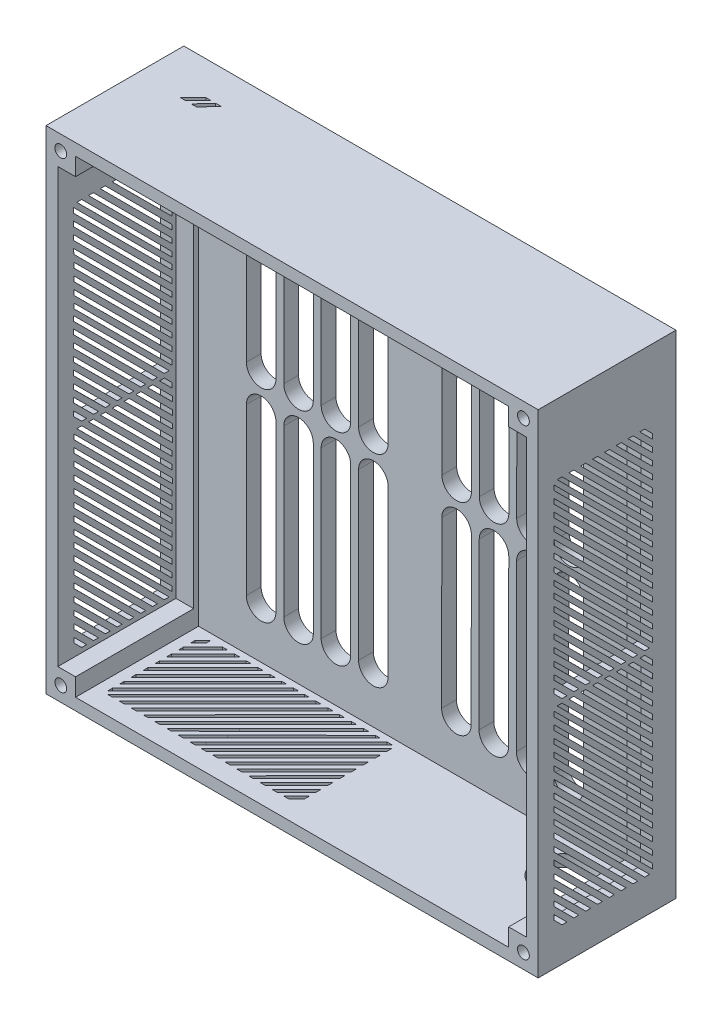
from build123d import *

# Parameters (mm, degrees)
ESBO_O1_W                = 250
ESBO_O1_H                = 250
RESSALTO_EXTRUS_O1_DEPTH = 70
ESBO_O2_W                = 238
ESBO_O2_H                = 238
CORTE_EXTRUS_O1_DEPTH    = 60
CORTE_EXTRUS_O2_DEPTH    = 341.014789418
ESBO_O7_W                = 220
ESBO_O7_H                = 229
CORTE_EXTRUS_O3_DEPTH    = 2.5
CORTE_EXTRUS_O4_DEPTH    = 284
ESBO_O10_W               = 9
ESBO_O10_H               = 9
RESSALTO_EXTRUS_O2_DEPTH = 60
ESBO_O11_R               = 3
CORTE_EXTRUS_O6_DEPTH    = 25
ESBO_O12_R               = 13.5
CORTE_EXTRUS_O7_DEPTH    = 10
CORTE_EXTRUS_O8_DEPTH    = 2


with BuildPart() as part:
    # Esboço1 → Ressalto-extrusão1 (new body)
    with BuildSketch(Plane.XY):
        with Locations((108.430425713, 114.833887043)):
            Rectangle(ESBO_O1_W, ESBO_O1_H)
    extrude(amount=RESSALTO_EXTRUS_O1_DEPTH)

    # Esboço2 → Corte-extrusão1 (cut)
    with BuildSketch(Plane.XY.offset(70)):
        with Locations((108.430425713, 114.833887043)):
            Rectangle(ESBO_O2_W, ESBO_O2_H)
    extrude(amount=-CORTE_EXTRUS_O1_DEPTH, mode=Mode.SUBTRACT)

    # Esboço6 → Corte-extrusão2 (cut, through all)
    with BuildSketch(Plane.XY.offset(10)):
        with BuildLine():
            Line((22.695507498, 208.167609342), (22.695507498, 124.153986831))
            ThreePointArc((22.695507498, 124.153986831), (30.195507498, 116.653986831), (37.695507498, 124.153986831))
            Line((37.695507498, 124.153986831), (37.695507498, 208.167609342))
            ThreePointArc((37.695507498, 208.167609342), (30.195507498, 215.667609342), (22.695507498, 208.167609342))
        make_face()
        with BuildLine():
            Line((41.695507498, 208.167609342), (41.695507498, 124.153986831))
            ThreePointArc((41.695507498, 124.153986831), (49.195507498, 116.653986831), (56.695507498, 124.153986831))
            Line((56.695507498, 124.153986831), (56.695507498, 208.167609342))
            ThreePointArc((56.695507498, 208.167609342), (49.195507498, 215.667609342), (41.695507498, 208.167609342))
        make_face()
        with BuildLine():
            Line((60.695507498, 208.167609342), (60.695507498, 124.153986831))
            ThreePointArc((60.695507498, 124.153986831), (68.195507498, 116.653986831), (75.695507498, 124.153986831))
            Line((75.695507498, 124.153986831), (75.695507498, 208.167609342))
            ThreePointArc((75.695507498, 208.167609342), (68.195507498, 215.667609342), (60.695507498, 208.167609342))
        make_face()
        with BuildLine():
            Line((79.695507498, 208.167609342), (79.695507498, 124.153986831))
            ThreePointArc((79.695507498, 124.153986831), (87.195507498, 116.653986831), (94.695507498, 124.153986831))
            Line((94.695507498, 124.153986831), (94.695507498, 208.167609342))
            ThreePointArc((94.695507498, 208.167609342), (87.195507498, 215.667609342), (79.695507498, 208.167609342))
        make_face()
        with BuildLine():
            Line((94.695507498, 105.513787255), (94.695507498, 21.500164744))
            ThreePointArc((94.695507498, 21.500164744), (87.195507498, 14.000164744), (79.695507498, 21.500164744))
            Line((79.695507498, 21.500164744), (79.695507498, 105.513787255))
            ThreePointArc((79.695507498, 105.513787255), (87.195507498, 113.013787255), (94.695507498, 105.513787255))
        make_face()
        with BuildLine():
            Line((75.695507498, 105.513787255), (75.695507498, 21.500164744))
            ThreePointArc((75.695507498, 21.500164744), (68.195507498, 14.000164744), (60.695507498, 21.500164744))
            Line((60.695507498, 21.500164744), (60.695507498, 105.513787255))
            ThreePointArc((60.695507498, 105.513787255), (68.195507498, 113.013787255), (75.695507498, 105.513787255))
        make_face()
        with BuildLine():
            Line((56.695507498, 105.513787256), (56.695507498, 21.500164744))
            ThreePointArc((56.695507498, 21.500164744), (49.195507498, 14.000164744), (41.695507498, 21.500164744))
            Line((41.695507498, 21.500164744), (41.695507498, 105.513787256))
            ThreePointArc((41.695507498, 105.513787256), (49.195507498, 113.013787256), (56.695507498, 105.513787256))
        make_face()
        with BuildLine():
            Line((37.695507498, 21.500164744), (37.695507498, 105.513787256))
            ThreePointArc((37.695507498, 105.513787256), (30.195507498, 113.013787256), (22.695507498, 105.513787256))
            Line((22.695507498, 105.513787256), (22.695507498, 21.500164744))
            ThreePointArc((22.695507498, 21.500164744), (30.195507498, 14.000164744), (37.695507498, 21.500164744))
        make_face()
        with BuildLine():
            Line((193.875104062, 21.383203899), (193.989910965, 105.396747967))
            ThreePointArc((193.989910965, 105.396747967), (186.500166922, 112.906989919), (178.989924971, 105.417245876))
            Line((178.989924971, 105.417245876), (178.875118068, 21.403701808))
            ThreePointArc((178.875118068, 21.403701808), (186.364862111, 13.893459856), (193.875104062, 21.383203899))
        make_face()
        with BuildLine():
            Line((174.875121802, 21.409167917), (174.989928706, 105.422711985))
            ThreePointArc((174.989928706, 105.422711985), (167.500184663, 112.932953936), (159.989942711, 105.443209893))
            Line((159.989942711, 105.443209893), (159.875135808, 21.429665825))
            ThreePointArc((159.875135808, 21.429665825), (167.364879851, 13.919423874), (174.875121802, 21.409167917))
        make_face()
        with BuildLine():
            Line((155.875139543, 21.435131934), (155.989946446, 105.448676002))
            ThreePointArc((155.989946446, 105.448676002), (148.500202403, 112.958917953), (140.989960451, 105.46917391))
            Line((140.989960451, 105.46917391), (140.875153548, 21.455629843))
            ThreePointArc((140.875153548, 21.455629843), (148.364897591, 13.945387891), (155.875139543, 21.435131934))
        make_face()
        with BuildLine():
            Line((136.875157283, 21.461095951), (136.989964186, 105.474640019))
            ThreePointArc((136.989964186, 105.474640019), (129.500220143, 112.984881971), (121.989978192, 105.495137928))
            Line((121.989978192, 105.495137928), (121.875171288, 21.48159386))
            ThreePointArc((121.875171288, 21.48159386), (129.364915331, 13.971351908), (136.875157283, 21.461095951))
        make_face()
        with BuildLine():
            Line((122.015450532, 124.135320099), (122.130257436, 208.148864167))
            ThreePointArc((122.130257436, 208.148864167), (129.640499387, 215.63860821), (137.13024343, 208.128366259))
            Line((137.13024343, 208.128366259), (137.015436527, 124.114822191))
            ThreePointArc((137.015436527, 124.114822191), (129.505194575, 116.625078148), (122.015450532, 124.135320099))
        make_face()
        with BuildLine():
            Line((141.015432792, 124.109356082), (141.130239695, 208.122900149))
            ThreePointArc((141.130239695, 208.122900149), (148.640481647, 215.612644192), (156.13022569, 208.102402241))
            Line((156.13022569, 208.102402241), (156.015418786, 124.088858173))
            ThreePointArc((156.015418786, 124.088858173), (148.505176835, 116.59911413), (141.015432792, 124.109356082))
        make_face()
        with BuildLine():
            Line((160.015415052, 124.083392064), (160.130221955, 208.096936132))
            ThreePointArc((160.130221955, 208.096936132), (167.640463907, 215.586680175), (175.13020795, 208.076438223))
            Line((175.13020795, 208.076438223), (175.015401046, 124.062894155))
            ThreePointArc((175.015401046, 124.062894155), (167.505159095, 116.573150112), (160.015415052, 124.083392064))
        make_face()
        with BuildLine():
            Line((179.130204215, 208.070972114), (179.015397311, 124.057428046))
            ThreePointArc((179.015397311, 124.057428046), (186.505141354, 116.547186095), (194.015383306, 124.036930138))
            Line((194.015383306, 124.036930138), (194.130190209, 208.050474206))
            ThreePointArc((194.130190209, 208.050474206), (186.640446166, 215.560716158), (179.130204215, 208.070972114))
        make_face()
    extrude(amount=-CORTE_EXTRUS_O2_DEPTH, mode=Mode.SUBTRACT)

    # Esboço7 → Corte-extrusão3 (cut)
    with BuildSketch(Plane.XY.offset(10)):
        with Locations((108.430425713, 110.333887043)):
            Rectangle(ESBO_O7_W, ESBO_O7_H)
    extrude(amount=-CORTE_EXTRUS_O3_DEPTH, mode=Mode.SUBTRACT)

    # Esboço8 → Corte-extrusão4 (cut)
    with BuildSketch(Plane.ZY.offset(16.569574287)):
        Polygon((11.920954387, 200.295216491), (15.882594698, 204.256856802), (18.382594698, 204.256856802), (11.920954387, 197.795216491), align=None)
        Polygon((11.877651038, 194.340054495), (21.78303626, 204.256856802), (24.382594698, 204.256856802), (11.879090975, 191.84005491), align=None)
        Polygon((11.887282735, 188.325338957), (27.8159346, 204.256856802), (30.382594698, 204.256856802), (11.887507622, 185.825338967), align=None)
        Polygon((11.889434685, 182.329414597), (33.819670411, 204.256856802), (36.382594698, 204.256856802), (11.889275447, 179.829414602), align=None)
        Polygon((11.890934109, 176.327179154), (39.837394675, 204.256856802), (42.382594698, 204.256856802), (11.890183211, 173.827179266), align=None)
        Polygon((11.964038432, 170.295408005), (45.882594698, 204.256856802), (48.42548723, 204.256856802), (11.964038432, 167.795408005), align=None)
        Polygon((11.921270161, 164.295532265), (51.929239829, 204.256856802), (54.432478905, 204.256856802), (11.921270161, 161.795532265), align=None)
        Polygon((11.8968556, 158.327055291), (57.882594698, 204.256856802), (60.382594698, 204.256856802), (11.895374458, 155.82705573), align=None)
        Polygon((61.937307697, 202.70030051), (61.934345413, 200.200302265), (15.950087018, 154.267754152), (11.920954387, 150.243177187), (11.920954387, 152.743177187), (13.450087457, 154.270499438), align=None)
        Polygon((61.930257324, 196.750188894), (61.927291202, 194.246951575), (24.4772154, 156.722273503), (11.961361665, 144.184457239), (11.964059174, 146.684455784), (21.984605044, 156.724963041), align=None)
        Polygon((61.923139558, 190.743201435), (61.92012645, 188.200310689), (30.416290711, 156.715865211), (11.954885602, 138.182570488), (11.957583112, 140.682569032), (27.877587947, 156.718604483), align=None)
        Polygon((61.915979252, 184.700313146), (61.91296341, 182.155114909), (36.456923768, 156.709347341), (11.948441986, 132.210755273), (11.951107294, 134.680909705), (33.919008845, 156.712085763), align=None)
        Polygon((61.90886977, 178.700317358), (61.905832927, 176.137394871), (42.454738132, 156.702875672), (11.941973741, 126.216113277), (11.944631982, 128.679718557), (39.924569035, 156.705605736), align=None)
        Polygon((61.901760289, 172.70032157), (61.898719018, 170.133663274), (48.446482457, 156.696410553), (11.935510496, 120.226106519), (11.938162819, 122.684226878), (45.924003427, 156.699132319), align=None)
        Polygon((61.894650807, 166.700325782), (61.891570555, 164.100769169), (54.466126239, 156.68991533), (11.929047597, 114.236419065), (11.931697999, 116.692759781), (51.95149329, 156.692628631), align=None)
        Polygon((61.887541326, 160.700329994), (61.884579042, 158.200331749), (60.366158963, 156.683549169), (11.922633829, 108.292266617), (11.922299432, 110.727656337), (57.858559852, 156.686254879), align=None)
        Polygon((13.477429253, 106.735792656), (15.912817195, 106.732830464), (61.920954387, 152.619474637), (61.920954387, 155.127075208), align=None)
        Polygon((19.421585163, 106.735792656), (21.877927308, 106.735792656), (61.920954387, 146.712404637), (61.920954387, 149.22703905), align=None)
        Polygon((25.411276103, 106.735792656), (27.869397892, 106.735792656), (61.920954387, 140.684911265), (61.920954387, 143.207391764), align=None)
        Polygon((31.401286347, 106.735792656), (33.864893062, 106.735792656), (61.920954387, 134.685473381), (61.920954387, 137.21564395), align=None)
        Polygon((37.395931833, 106.735792656), (39.866087703, 106.735792656), (61.920954387, 128.679909695), (61.920954387, 131.217826095), align=None)
        Polygon((43.367750524, 106.735792656), (45.867750524, 106.735792656), (61.920954387, 122.638485279), (61.920954387, 125.177189522), align=None)
        Polygon((49.36964077, 106.735792656), (51.86964077, 106.735792656), (61.92095439, 116.745498947), (61.92095439, 119.238110753), align=None)
        Polygon((55.41253037, 106.735792656), (57.91253037, 106.735792656), (61.920954387, 110.727623835), (61.931346133, 113.227623835), align=None)
        Polygon((11.895615494, 100.730742173), (15.857255805, 104.692382484), (18.357255805, 104.692382484), (11.895615494, 98.230742173), align=None)
        Polygon((11.852312146, 94.775580177), (21.757697368, 104.692382484), (24.357255805, 104.692382484), (11.853752083, 92.275580592), align=None)
        Polygon((11.861943842, 88.760864638), (27.790595707, 104.692382484), (30.357255805, 104.692382484), (11.86216873, 86.260864648), align=None)
        Polygon((11.864095793, 82.764940279), (33.794331519, 104.692382484), (36.357255805, 104.692382484), (11.863936555, 80.264940284), align=None)
        Polygon((11.865595216, 76.762704835), (39.812055782, 104.692382484), (42.357255805, 104.692382484), (11.864844318, 74.262704948), align=None)
        Polygon((11.93869954, 70.730933686), (45.857255805, 104.692382484), (48.400148337, 104.692382484), (11.93869954, 68.230933686), align=None)
        Polygon((11.895931269, 64.731057947), (51.903900936, 104.692382484), (54.407140012, 104.692382484), (11.895931269, 62.231057947), align=None)
        Polygon((11.871516708, 58.762580973), (57.857255805, 104.692382484), (60.357255805, 104.692382484), (11.870035565, 56.262581412), align=None)
        Polygon((61.911968804, 103.135826191), (61.90900652, 100.635827946), (15.924748126, 54.703279833), (11.895615494, 50.678702868), (11.895615494, 53.178702868), (13.424748564, 54.70602512), align=None)
        Polygon((61.904918431, 97.185714575), (61.901952309, 94.682477257), (24.451876506, 57.157799184), (11.936022772, 44.619982921), (11.938720282, 47.119981466), (21.95926615, 57.160488722), align=None)
        Polygon((61.897800665, 91.178727117), (61.894787557, 88.635836371), (30.390951819, 57.151390893), (11.929546709, 38.618096169), (11.932244219, 41.118094714), (27.852249054, 57.154130165), align=None)
        Polygon((61.89064036, 85.135838828), (61.887624517, 82.590640591), (36.431584875, 57.144873023), (11.923103094, 32.646280955), (11.925768402, 35.116435387), (33.893669953, 57.147611444), align=None)
        Polygon((61.883530878, 79.13584304), (61.880494034, 76.572920552), (42.429399239, 57.138401354), (11.916634848, 26.651638958), (11.919293089, 29.115244239), (39.899230142, 57.141131418), align=None)
        Polygon((61.876421396, 73.135847252), (61.873380126, 70.569188956), (48.421143565, 57.131936235), (11.910171604, 20.661632201), (11.912823927, 23.119752559), (45.898664535, 57.134658001), align=None)
        Polygon((61.869311915, 67.135851464), (61.866231663, 64.536294851), (54.440787346, 57.125441012), (11.903708704, 14.671944747), (11.906359107, 17.128285462), (51.926154398, 57.128154312), align=None)
        Polygon((61.862202433, 61.135855676), (61.859240149, 58.635857431), (60.34082007, 57.11907485), (11.897294937, 8.727792298), (11.896960539, 11.163182019), (57.833220959, 57.121780561), align=None)
        Polygon((13.452090361, 7.171318338), (15.887478303, 7.168356145), (61.895615494, 53.055000319), (61.895615494, 55.56260089), align=None)
        Polygon((19.39624627, 7.171318338), (21.852588415, 7.171318338), (61.895615494, 47.147930319), (61.895615494, 49.662564731), align=None)
        Polygon((25.385937211, 7.171318338), (27.844059, 7.171318338), (61.895615494, 41.120436947), (61.895615494, 43.642917446), align=None)
        Polygon((31.375947455, 7.171318338), (33.83955417, 7.171318338), (61.895615494, 35.120999062), (61.895615494, 37.651169632), align=None)
        Polygon((37.370592941, 7.171318338), (39.840748811, 7.171318338), (61.895615494, 29.115435377), (61.895615494, 31.653351776), align=None)
        Polygon((43.342411632, 7.171318338), (45.842411632, 7.171318338), (61.895615494, 23.074010961), (61.895615494, 25.612715204), align=None)
        Polygon((49.344301877, 7.171318338), (51.844301877, 7.171318338), (61.895615496, 17.181024627), (61.895615496, 19.673636434), align=None)
        Polygon((55.387191478, 7.171318338), (57.887191478, 7.171318338), (61.895615494, 11.163149517), (61.90600724, 13.663149517), align=None)
    extrude(amount=-CORTE_EXTRUS_O4_DEPTH, mode=Mode.SUBTRACT)

    # Esboço10 → Ressalto-extrusão2 (add)
    with BuildSketch(Plane.XY.offset(10)):
        with Locations((-6.069574287, 229.333887043)):
            Rectangle(ESBO_O10_W, ESBO_O10_H)
        with Locations((222.930425713, 229.333887043)):
            Rectangle(ESBO_O10_W, ESBO_O10_H)
        with Locations((222.930425713, 0.333887043)):
            Rectangle(ESBO_O10_W, ESBO_O10_H)
        with Locations((-6.069574287, 0.333887043)):
            Rectangle(ESBO_O10_W, ESBO_O10_H)
    extrude(amount=RESSALTO_EXTRUS_O2_DEPTH)

    # Esboço11 → Corte-extrusão6 (cut)
    with BuildSketch(Plane.XY.offset(70)):
        with Locations((-9.069574287, 232.333887043)):
            Circle(ESBO_O11_R)
        with Locations((225.930425713, 232.333887043)):
            Circle(ESBO_O11_R)
        with Locations((-9.069574287, -2.666112957)):
            Circle(ESBO_O11_R)
        with Locations((225.930425713, -2.666112957)):
            Circle(ESBO_O11_R)
    extrude(amount=-CORTE_EXTRUS_O6_DEPTH, mode=Mode.SUBTRACT)

    # Esboço12 → Corte-extrusão7 (cut)
    with BuildSketch(Plane.XZ.offset(10.166112957)):
        with Locations((200.485605127, 24.656721414)):
            Circle(ESBO_O12_R)
        Polygon((97.339878372, 60.59143644), (101.301518682, 56.629796129), (101.301518682, 54.129796129), (94.839878372, 60.59143644), align=None)
        Polygon((91.384716376, 60.634739789), (101.301518682, 50.729354567), (101.301518682, 48.129796129), (88.884716791, 60.633299852), align=None)
        Polygon((85.370000837, 60.625108093), (101.301518682, 44.696456227), (101.301518682, 42.129796129), (82.870000847, 60.624883205), align=None)
        Polygon((79.374076478, 60.622956142), (101.301518682, 38.692720416), (101.301518682, 36.129796129), (76.874076483, 60.62311538), align=None)
        Polygon((73.371841034, 60.621456718), (101.301518682, 32.674996153), (101.301518682, 30.129796129), (70.871841147, 60.622207616), align=None)
        Polygon((67.340069885, 60.548352395), (101.301518682, 26.629796129), (101.301518682, 24.086903598), (64.840069885, 60.548352395), align=None)
        Polygon((61.340194146, 60.591120666), (101.301518682, 20.583150998), (101.301518682, 18.079911922), (58.840194146, 60.591120666), align=None)
        Polygon((55.371717172, 60.615535227), (101.301518682, 14.629796129), (101.301518682, 12.129796129), (52.871717611, 60.617016369), align=None)
        Polygon((99.74496239, 10.57508313), (97.244964145, 10.578045414), (51.312416026, 56.562303815), (47.287839067, 60.59143644), (49.787839067, 60.59143644), (51.315161318, 59.06230337), align=None)
        Polygon((93.794850774, 10.582133504), (91.291613456, 10.585099626), (53.766935386, 48.035175425), (41.22911912, 60.551029163), (43.729117664, 60.548331653), (53.769624924, 50.527785781), align=None)
        Polygon((87.787863316, 10.58925127), (85.244972569, 10.592264378), (53.760527092, 42.096100116), (35.227232368, 60.557505225), (37.727230913, 60.554807716), (53.763266363, 44.634802881), align=None)
        Polygon((81.744975026, 10.596411575), (79.19977679, 10.599427417), (53.754009221, 36.05546706), (29.255417153, 60.563948841), (31.725571586, 60.561283533), (53.756747643, 38.593381982), align=None)
        Polygon((75.744979238, 10.603521057), (73.182056751, 10.606557901), (53.747537553, 30.057652696), (23.260775157, 60.570417087), (25.724380438, 60.567758845), (53.750267617, 32.587821792), align=None)
        Polygon((69.74498345, 10.610630538), (67.178325154, 10.613671809), (53.741072434, 24.06590837), (17.2707684, 60.576880331), (19.728888758, 60.574228008), (53.7437942, 26.5883874), align=None)
        Polygon((63.744987663, 10.61774002), (61.14543105, 10.620820272), (53.734577211, 18.046264588), (11.281080946, 60.583343231), (13.737421661, 60.580692828), (53.737290511, 20.560897537), align=None)
        Polygon((57.744991875, 10.624849501), (55.24499363, 10.627811785), (53.728211049, 12.146231864), (5.336928497, 60.589756998), (7.772318217, 60.590091396), (53.73091676, 14.653830975), align=None)
        Polygon((3.780454537, 59.034961574), (3.777492344, 56.599573632), (49.664136518, 10.59143644), (52.171737089, 10.59143644), align=None)
        Polygon((3.780454537, 53.090805665), (3.780454537, 50.634463519), (43.757066518, 10.59143644), (46.27170093, 10.59143644), align=None)
        Polygon((3.780454537, 47.101114724), (3.780454537, 44.642992935), (37.729573146, 10.59143644), (40.252053644, 10.59143644), align=None)
        Polygon((3.780454537, 41.11110448), (3.780454537, 38.647497765), (31.730135261, 10.59143644), (34.260305831, 10.59143644), align=None)
        Polygon((3.780454537, 35.116458994), (3.780454537, 32.646303124), (25.724571576, 10.59143644), (28.262487975, 10.59143644), align=None)
        Polygon((3.780454537, 29.144640303), (3.780454537, 26.644640303), (19.68314716, 10.59143644), (22.221851403, 10.59143644), align=None)
        Polygon((3.780454537, 23.142750057), (3.780454537, 20.642750057), (13.790160829, 10.591436435), (16.282772636, 10.591436435), align=None)
        Polygon((3.780454537, 17.099860457), (3.780454537, 14.599860457), (7.772285715, 10.59143644), (7.772285715, 13.09143644), align=None)
    extrude(amount=-CORTE_EXTRUS_O7_DEPTH, mode=Mode.SUBTRACT)

    # Esboço13 → Corte-extrusão8 (cut)
    with BuildSketch(Plane(origin=(0, 239.833887043, 0), x_dir=(1, 0, 0), z_dir=(0, 1, 0))):
        Polygon((5.268757587, -23.578601012), (11.753607331, -17.093751268), (14.503607331, -17.093751268), (8.018757587, -23.578601012), align=None)
        Polygon((10.802241344, -23.578601012), (16.69840733, -17.093751268), (19.44840733, -17.093751268), (13.552241344, -23.578601012), align=None)
    extrude(amount=-CORTE_EXTRUS_O8_DEPTH, mode=Mode.SUBTRACT)


solid = part.part
